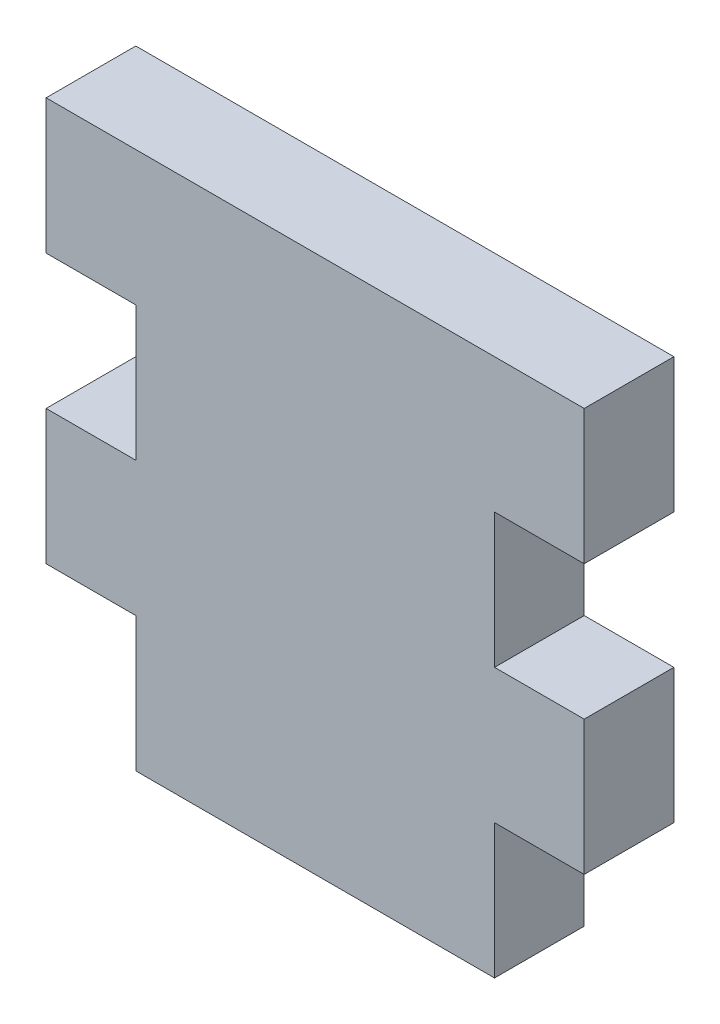
from build123d import *

# Parameters (mm, degrees)
SKETCH1_W           = 38.1
SKETCH1_H           = 38.1
BOSS_EXTRUDE1_DEPTH = 6.35
SKETCH2_W           = 6.35
SKETCH2_H           = 9.525
CUT_EXTRUDE1_DEPTH  = 92.514002316


with BuildPart() as part:
    # Sketch1 → Boss-Extrude1 (new body)
    with BuildSketch(Plane.XY):
        with Locations((-69.035249325, -4.939142782)):
            Rectangle(SKETCH1_W, SKETCH1_H)
    extrude(amount=BOSS_EXTRUDE1_DEPTH)

    # Sketch2 → Cut-Extrude1 (cut, through all)
    with BuildSketch(Plane.XY.offset(6.35)):
        with Locations((-84.910249325, -19.226642782)):
            Rectangle(SKETCH2_W, SKETCH2_H)
        with Locations((-84.910249325, -0.176642782)):
            Rectangle(SKETCH2_W, SKETCH2_H)
        with Locations((-53.160249325, -0.176642782)):
            Rectangle(SKETCH2_W, SKETCH2_H)
        with Locations((-53.160249325, -19.226642782)):
            Rectangle(SKETCH2_W, SKETCH2_H)
    extrude(amount=-CUT_EXTRUDE1_DEPTH, mode=Mode.SUBTRACT)


solid = part.part
